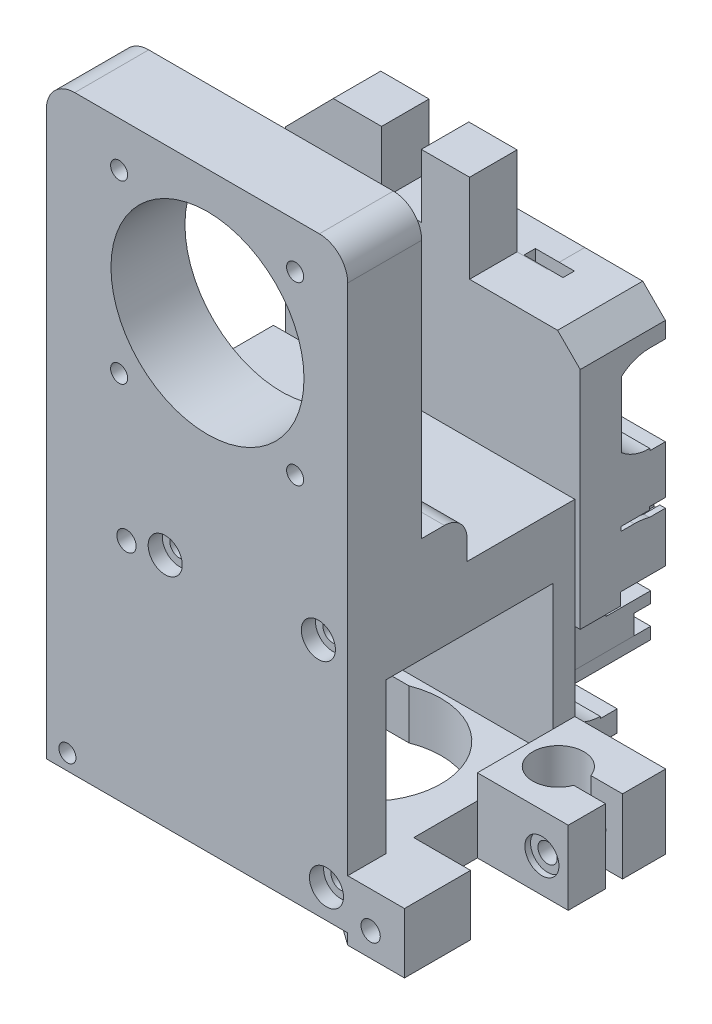
from build123d import *
from OCP.BRepAlgoAPI import BRepAlgoAPI_Cut
from OCP.TopTools import TopTools_ListOfShape

# Parameters (mm, degrees)
SKETCH1_W                     = 45
SKETCH1_H                     = 45
BOSS_EXTRUDE1_DEPTH           = 35
SKETCH2_R                     = 13
CUT_EXTRUDE3_DEPTH            = 35
SKETCH4_R                     = 1.7
CUT_EXTRUDE8_DEPTH            = 35
SKETCH7_R                     = 1.7
CUT_EXTRUDE9_DEPTH            = 35
SKETCH6_R                     = 1.7
CUT_EXTRUDE10_DEPTH           = 35
SKETCH5_R                     = 1.7
CUT_EXTRUDE11_DEPTH           = 35
CUT_EXTRUDE12_DEPTH           = 12
BOSS_EXTRUDE4_DEPTH           = 2
BOSS_EXTRUDE4_DEPTH_BACK      = 37.5
SKETCH14_W                    = 6
SKETCH14_H                    = 6
CUT_EXTRUDE17_START           = -7
SKETCH20_R                    = 2.2
CUT_EXTRUDE17_DEPTH           = 70.77141069
SKETCH21_R                    = 1.75
CUT_EXTRUDE18_DEPTH           = 2
BOSS_EXTRUDE5_DEPTH           = 44.571207257
BOSS_EXTRUDE5_DEPTH_BACK      = 1.562633388
SKETCH22_W                    = 53.082637552
SKETCH22_H                    = 40.002520942
SKETCH23_W                    = 29.449729346
SKETCH23_H                    = 26.517519529
CUT_EXTRUDE19_DEPTH           = 95.427299018
SKETCH25_R                    = 5
CUT_EXTRUDE24_DEPTH           = 2.6
SKETCH26_R                    = 8.1
CUT_EXTRUDE25_DEPTH           = 4
SKETCH27_R                    = 6.7
CUT_EXTRUDE28_DEPTH           = 6
SKETCH30_R                    = 13
CUT_EXTRUDE30_DEPTH           = 10.767560088
SKETCH31_W                    = 19.349450051
SKETCH31_H                    = 23.644133728
CUT_EXTRUDE31_DEPTH           = 9.664293754
SKETCH34_R                    = 1.5
CUT_EXTRUDE32_DEPTH           = 9
SKETCH37_W                    = 11.635024897
SKETCH37_H                    = 10.599921236
BOSS_EXTRUDE6_DEPTH           = 10
BOSS_EXTRUDE6_OTHER_WAY_DEPTH = 5
BOSS_EXTRUDE6_OTHER_WAY_TAPER = 29
SKETCH38_R                    = 1.700000001
CUT_EXTRUDE33_DEPTH           = 10
SKETCH39_R                    = 1.700000001
CUT_EXTRUDE34_DEPTH           = 88.0662855
SKETCH40_W                    = 17.159872711
SKETCH40_H                    = 13
BOSS_EXTRUDE7_DEPTH           = 16
SKETCH41_R                    = 4.5
CUT_EXTRUDE35_DEPTH           = 15
SKETCH42_W                    = 9.331425876
SKETCH42_H                    = 3
CUT_EXTRUDE36_DEPTH           = 15
CUT_EXTRUDE37_DEPTH           = 5
SKETCH44_R                    = 1.7
CUT_EXTRUDE38_DEPTH           = 23
CUT_EXTRUDE39_DEPTH           = 5
CUT_EXTRUDE40_DEPTH           = 5
CUT_EXTRUDE41_DEPTH           = 5
SKETCH53_R                    = 1.7
CUT_EXTRUDE42_DEPTH           = 90.646740997
SKETCH52_R                    = 1.7
CUT_EXTRUDE43_DEPTH           = 90.646740997
SKETCH51_R                    = 1.7
CUT_EXTRUDE44_DEPTH           = 90.646740997
CUT_EXTRUDE46_DEPTH           = 5
SKETCH57_R                    = 3
CUT_EXTRUDE48_DEPTH           = 2.5
SKETCH58_R                    = 3
CUT_EXTRUDE49_DEPTH           = 2.5
SKETCH59_R                    = 3
CUT_EXTRUDE50_DEPTH           = 2.5
SKETCH60_R                    = 3
CUT_EXTRUDE51_DEPTH           = 1
SKETCH61_W                    = 6.542017971
SKETCH61_H                    = 14.030300317
CUT_EXTRUDE52_DEPTH           = 6.5
SKETCH67_W                    = 5.604230097
SKETCH67_H                    = 8.996545788
BOSS_EXTRUDE8_DEPTH           = 33
SKETCH68_W                    = 5.604230097
SKETCH68_H                    = 9.400155495
BOSS_EXTRUDE9_DEPTH           = 33
SKETCH63_R                    = 1.7
CUT_EXTRUDE55_DEPTH           = 102.92049818
SKETCH62_R                    = 1.7
CUT_EXTRUDE56_DEPTH           = 102.92049818
SKETCH69_R                    = 3
CUT_EXTRUDE57_DEPTH           = 2.5
CUT_EXTRUDE58_DEPTH           = 2.5
SKETCH71_R                    = 3
CUT_EXTRUDE59_DEPTH           = 1
SKETCH73_R                    = 1.5
CUT_EXTRUDE61_DEPTH           = 5
SKETCH79_W                    = 95.658931194
SKETCH79_H                    = 51.290788201
CUT_EXTRUDE62_DEPTH           = 59
SKETCH80_W                    = 53.082637552
SKETCH80_H                    = 13.031868173
BOSS_EXTRUDE10_DEPTH          = 58
FILLET1_R                     = 5
SKETCH84_R                    = 17
CUT_EXTRUDE63_DEPTH           = 22
SKETCH85_R                    = 1.5
CUT_EXTRUDE64_DEPTH           = 15
SKETCH86_W                    = 15
SKETCH86_H                    = 8
BOSS_EXTRUDE11_DEPTH          = 7.5
FILLET3_R                     = 3
SKETCH87_W                    = 10
SKETCH87_H                    = 8
BOSS_EXTRUDE12_DEPTH          = 7.5
FILLET6_R                     = 4
BOSS_EXTRUDE13_DEPTH          = 15
SKETCH93_R                    = 7.627151398
CUT_EXTRUDE66_DEPTH           = 49.5
CUT_EXTRUDE67_DEPTH           = 53.5
SKETCH95_R                    = 7.676402713
CUT_EXTRUDE68_DEPTH           = 25.2
CUT_EXTRUDE69_DEPTH           = 34.5
CUT_EXTRUDE70_DEPTH           = 97.513539563
CUT_EXTRUDE70_DEPTH_BACK      = 97.513539563
SKETCH98_W                    = 8.013106882
SKETCH98_H                    = 5.054927498
SKETCH99_W                    = 2.898184018
SKETCH99_H                    = 3.4444183
CUT_EXTRUDE71_DEPTH           = 49.5
CUT_EXTRUDE75_DEPTH           = 2.8
CUT_EXTRUDE76_DEPTH           = 7.8
FILLET9_R                     = 10
CUT_EXTRUDE77_DEPTH           = 2.8
CUT_EXTRUDE78_DEPTH           = 7.8
SKETCH109_W                   = 3.474802874
SKETCH109_H                   = 1.768914447
SKETCH112_W                   = 3.556792111
SKETCH112_H                   = 1.806926474
CUT_EXTRUDE79_DEPTH           = 1
SKETCH116_W                   = 11.383905976
SKETCH116_H                   = 17.385394655
CUT_EXTRUDE80_DEPTH           = 64
CUT_EXTRUDE81_DEPTH           = 1


with BuildPart() as part:
    # Sketch1 → Boss-Extrude1 (new body)
    with BuildSketch(Plane.XY):
        Rectangle(SKETCH1_W, SKETCH1_H)
    extrude(amount=BOSS_EXTRUDE1_DEPTH)

    # Sketch2 → Cut-Extrude3 (cut)
    with BuildSketch(Plane.XY.offset(35)):
        Circle(SKETCH2_R)
    extrude(amount=-CUT_EXTRUDE3_DEPTH, mode=Mode.SUBTRACT)

    # Sketch4 → Cut-Extrude8 (cut)
    with BuildSketch(Plane(origin=(0, 0, 0), x_dir=(-1, 0, 0), z_dir=(0, 0, -1))):
        with Locations((-15.808862622, 15.928817575)):
            Circle(SKETCH4_R)
    extrude(amount=-CUT_EXTRUDE8_DEPTH, mode=Mode.SUBTRACT)

    # Sketch7 → Cut-Extrude9 (cut)
    with BuildSketch(Plane(origin=(0, 0, 0), x_dir=(-1, 0, 0), z_dir=(0, 0, -1))):
        with Locations((15.199970606, 15.923392722)):
            Circle(SKETCH7_R)
    extrude(amount=-CUT_EXTRUDE9_DEPTH, mode=Mode.SUBTRACT)

    # Sketch6 → Cut-Extrude10 (cut)
    with BuildSketch(Plane(origin=(0, 0, 0), x_dir=(-1, 0, 0), z_dir=(0, 0, -1))):
        with Locations((15.22029943, -15.065721832)):
            Circle(SKETCH6_R)
    extrude(amount=-CUT_EXTRUDE10_DEPTH, mode=Mode.SUBTRACT)

    # Sketch5 → Cut-Extrude11 (cut)
    with BuildSketch(Plane(origin=(0, 0, 0), x_dir=(-1, 0, 0), z_dir=(0, 0, -1))):
        with Locations((-15.781319068, -15.06525873)):
            Circle(SKETCH5_R)
    extrude(amount=-CUT_EXTRUDE11_DEPTH, mode=Mode.SUBTRACT)

    # Sketch8 → Cut-Extrude12 (cut)
    with BuildSketch(Plane(origin=(22.5, 0, 0), x_dir=(0, 0, -1), z_dir=(1, 0, 0))):
        Polygon((-4.363915061, -12.036124724), (-35, -12.036124724), (-35, 22.5), (-8.423058519, 22.5), (-8.423058519, 12.925541512), (-4.363915061, 12.925541512), align=None)
    extrude(amount=-CUT_EXTRUDE12_DEPTH, mode=Mode.SUBTRACT)

    # Sketch14 → Boss-Extrude4 (add, two sides: drawn at the far end of the back side and taken through both)
    with BuildSketch(Plane(origin=(0, 22.5, 0), x_dir=(1, 0, 0), z_dir=(0, 1, 0)).offset(-BOSS_EXTRUDE4_DEPTH_BACK)):
        with Locations((6.190916669, -17.729312446)):
            Rectangle(SKETCH14_W, SKETCH14_H)
    extrude(amount=BOSS_EXTRUDE4_DEPTH + BOSS_EXTRUDE4_DEPTH_BACK)

    # Sketch20 → Cut-Extrude17 (cut)
    with BuildSketch(Plane(origin=(0, 24.5, 0), x_dir=(1, 0, 0), z_dir=(0, 1, 0)).offset(CUT_EXTRUDE17_START)):
        with Locations(Location((6.190916669, -17.729312446, 0), (0, 0, 90))):
            Circle(SKETCH20_R)
    cut_extrude17 = extrude(amount=CUT_EXTRUDE17_DEPTH, mode=Mode.SUBTRACT)

    # Sketch21 → Cut-Extrude18 (cut)
    with BuildSketch(Plane(origin=(0, 17.5, 0), x_dir=(1, 0, 0), z_dir=(0, 1, 0))):
        with Locations(Location((6.190916669, -17.729312446, 0), (0, 0, 270))):
            Circle(SKETCH21_R)
    extrude(amount=-CUT_EXTRUDE18_DEPTH, mode=Mode.SUBTRACT)

    # Mirror6: Cut-Extrude17 across plane
    add(cut_extrude17.mirror(Plane.ZX.offset(16.5)), mode=Mode.SUBTRACT)

    # Sketch22 → Boss-Extrude5 (add, two sides: drawn at the far end of the back side and taken through both)
    with BuildSketch(Plane.XZ.offset(22.5).offset(-BOSS_EXTRUDE5_DEPTH_BACK)):
        with Locations((-1.541318776, 20.001258793)):
            Rectangle(SKETCH22_W, SKETCH22_H)
    extrude(amount=BOSS_EXTRUDE5_DEPTH + BOSS_EXTRUDE5_DEPTH_BACK)

    # Sketch23 → Cut-Extrude19 (cut, through all)
    with BuildSketch(Plane.ZY.offset(28.082637552)):
        with Locations((18.529138975, -45.100264067)):
            Rectangle(SKETCH23_W, SKETCH23_H)
    extrude(amount=-CUT_EXTRUDE19_DEPTH, mode=Mode.SUBTRACT)

    # Sketch25 → Cut-Extrude24 (cut)
    with BuildSketch(Plane(origin=(0, -20.937366612, 0), x_dir=(1, 0, 0), z_dir=(0, 1, 0))):
        with Locations(Location((6.190916669, -17.729312446, 0), (0, 0, 270))):
            Circle(SKETCH25_R)
    extrude(amount=-CUT_EXTRUDE24_DEPTH, mode=Mode.SUBTRACT)

    # Sketch26 → Cut-Extrude25 (cut)
    with BuildSketch(Plane(origin=(0, -23.537366612, 0), x_dir=(1, 0, 0), z_dir=(0, 1, 0))):
        with Locations(Location((6.190916669, -17.729312446, 0), (0, 0, 270))):
            Circle(SKETCH26_R)
    extrude(amount=-CUT_EXTRUDE25_DEPTH, mode=Mode.SUBTRACT)

    # Sketch27 → Cut-Extrude28 (cut)
    with BuildSketch(Plane(origin=(0, -27.537366612, 0), x_dir=(1, 0, 0), z_dir=(0, 1, 0))):
        with Locations(Location((6.190916669, -17.729312446, 0), (0, 0, 270))):
            Circle(SKETCH27_R)
    extrude(amount=-CUT_EXTRUDE28_DEPTH, mode=Mode.SUBTRACT)

    # Sketch30 → Cut-Extrude30 (cut)
    with BuildSketch(Plane(origin=(0, -58.359023831, 0), x_dir=(1, 0, 0), z_dir=(0, 1, 0))):
        with Locations(Location((6.207851035, -17.729312446, 0), (0, 0, 270))):
            Circle(SKETCH30_R)
    extrude(amount=-CUT_EXTRUDE30_DEPTH, mode=Mode.SUBTRACT)

    # Sketch31 → Cut-Extrude31 (cut)
    with BuildSketch(Plane.XZ.offset(67.071207257)):
        with Locations((-7.592166715, 17.462222744)):
            Rectangle(SKETCH31_W, SKETCH31_H)
    extrude(amount=-CUT_EXTRUDE31_DEPTH, mode=Mode.SUBTRACT)

    # Sketch34 → Cut-Extrude32 (cut)
    with BuildSketch(Plane.ZY.offset(28.082637552)):
        with Locations((35.530918006, -28.494957131)):
            Circle(SKETCH34_R)
        with Locations((3.530918006, -28.494957131)):
            Circle(SKETCH34_R)
        with Locations((35.530918006, -60.494957131)):
            Circle(SKETCH34_R)
        with Locations((3.530918006, -60.494957131)):
            Circle(SKETCH34_R)
    extrude(amount=-CUT_EXTRUDE32_DEPTH, mode=Mode.SUBTRACT)

    # Sketch37 → Boss-Extrude6 (add)
    with BuildSketch(Plane(origin=(25, 0, 0), x_dir=(0, 0, -1), z_dir=(1, 0, 0))):
        with Locations((-34.185004037, -63.658986353)):
            Rectangle(SKETCH37_W, SKETCH37_H)
    extrude(amount=BOSS_EXTRUDE6_DEPTH)

    # Sketch37 → Boss-Extrude6 other way (add)
    with BuildSketch(Plane(origin=(25, 0, 0), x_dir=(0, 0, -1), z_dir=(1, 0, 0))):
        with Locations((-34.185004037, -63.658986353)):
            Rectangle(SKETCH37_W, SKETCH37_H)
    extrude(amount=-BOSS_EXTRUDE6_OTHER_WAY_DEPTH, taper=BOSS_EXTRUDE6_OTHER_WAY_TAPER)

    # Sketch38 → Cut-Extrude33 (cut)
    with BuildSketch(Plane.XY.offset(40.002519264)):
        with Locations((29.034907303, -64.748396147)):
            Circle(SKETCH38_R)
    extrude(amount=-CUT_EXTRUDE33_DEPTH, mode=Mode.SUBTRACT)

    # Sketch39 → Cut-Extrude34 (cut, through all)
    with BuildSketch(Plane.XY.offset(40.002519264)):
        with Locations((-13.965092697, -26.748396147)):
            Circle(SKETCH39_R)
    extrude(amount=-CUT_EXTRUDE34_DEPTH, mode=Mode.SUBTRACT)

    # Sketch40 → Boss-Extrude7 (add)
    with BuildSketch(Plane(origin=(25, 0, 0), x_dir=(0, 0, -1), z_dir=(1, 0, 0))):
        with Locations((-8.579933523, -60.571207257)):
            Rectangle(SKETCH40_W, SKETCH40_H)
    extrude(amount=BOSS_EXTRUDE7_DEPTH)

    # Sketch41 → Cut-Extrude35 (cut)
    with BuildSketch(Plane(origin=(0, -54.071207257, 1.269334023), x_dir=(1, 0, 0), z_dir=(0, 1, 0))):
        with Locations(Location((31.163890056, -7.793414205, 0), (0, 0, 270))):
            Circle(SKETCH41_R)
    extrude(amount=-CUT_EXTRUDE35_DEPTH, mode=Mode.SUBTRACT)

    # Sketch42 → Cut-Extrude36 (cut)
    with BuildSketch(Plane(origin=(0, -54.071207257, 0), x_dir=(1, 0, 0), z_dir=(0, 1, 0))):
        with Locations((38.19390682, -9.095710432)):
            Rectangle(SKETCH42_W, SKETCH42_H)
    extrude(amount=-CUT_EXTRUDE36_DEPTH, mode=Mode.SUBTRACT)


with BuildPart() as cut_extrude37_tool:
    # Sketch43 → Cut-Extrude37 (new body)
    with BuildSketch(Plane(origin=(0, 0, 0), x_dir=(-1, 0, 0), z_dir=(0, 0, -1))):
        Polygon((-34.628927379, -64.403909926), (-32.738460245, -61.095415705), (-34.658466721, -57.80397603), (-38.468940333, -57.821030577), (-40.359407467, -61.129524799), (-38.439400991, -64.420964473), align=None)
    extrude(amount=-CUT_EXTRUDE37_DEPTH)


with BuildPart() as part_1:
    add(part.part)

    # Cut-Extrude37: cut by cut_extrude37_tool, with a tolerance
    cut_extrude37_stock = TopTools_ListOfShape()
    cut_extrude37_stock.Append(part_1.part.wrapped)
    cut_extrude37_tools = TopTools_ListOfShape()
    cut_extrude37_tools.Append(cut_extrude37_tool.part.wrapped)
    cut_extrude37_cut = BRepAlgoAPI_Cut()
    cut_extrude37_cut.SetArguments(cut_extrude37_stock)
    cut_extrude37_cut.SetTools(cut_extrude37_tools)
    cut_extrude37_cut.SetFuzzyValue(0.00001)
    cut_extrude37_cut.Build()
    add(Compound.cast(cut_extrude37_cut.Shape()).solids(), mode=Mode.REPLACE)

    # Sketch44 → Cut-Extrude38 (cut)
    with BuildSketch(Plane.XY.offset(17.159869878)):
        with Locations(Location((36.360549159, -61.087091915, 0), (0, 0, 123.670539257))):
            Circle(SKETCH44_R)
    extrude(amount=-CUT_EXTRUDE38_DEPTH, mode=Mode.SUBTRACT)


with BuildPart() as cut_extrude39_tool:
    # Sketch48 → Cut-Extrude39 (new body)
    with BuildSketch(Plane(origin=(0, 0, 0), x_dir=(-1, 0, 0), z_dir=(0, 0, -1))):
        Polygon((9.066729233, -28.811078933), (10.957196368, -25.502584711), (9.037189891, -22.211145037), (5.22671628, -22.228199584), (3.336249145, -25.536693806), (5.256255622, -28.82813348), align=None)
    extrude(amount=-CUT_EXTRUDE39_DEPTH)


with BuildPart() as part_2:
    add(part_1.part)

    # Cut-Extrude39: cut by cut_extrude39_tool, with a tolerance
    cut_extrude39_stock = TopTools_ListOfShape()
    cut_extrude39_stock.Append(part_2.part.wrapped)
    cut_extrude39_tools = TopTools_ListOfShape()
    cut_extrude39_tools.Append(cut_extrude39_tool.part.wrapped)
    cut_extrude39_cut = BRepAlgoAPI_Cut()
    cut_extrude39_cut.SetArguments(cut_extrude39_stock)
    cut_extrude39_cut.SetTools(cut_extrude39_tools)
    cut_extrude39_cut.SetFuzzyValue(0.00001)
    cut_extrude39_cut.Build()
    add(Compound.cast(cut_extrude39_cut.Shape()).solids(), mode=Mode.REPLACE)


with BuildPart() as cut_extrude40_tool:
    # Sketch49 → Cut-Extrude40 (new body)
    with BuildSketch(Plane(origin=(0, 0, 0), x_dir=(-1, 0, 0), z_dir=(0, 0, -1))):
        Polygon((-19.339505263, -65.26594849), (-17.449038128, -61.957454268), (-19.369044605, -58.666014594), (-23.179518216, -58.683069141), (-25.06998535, -61.991563363), (-23.149978874, -65.283003037), align=None)
    extrude(amount=-CUT_EXTRUDE40_DEPTH)


with BuildPart() as part_3:
    add(part_2.part)

    # Cut-Extrude40: cut by cut_extrude40_tool, with a tolerance
    cut_extrude40_stock = TopTools_ListOfShape()
    cut_extrude40_stock.Append(part_3.part.wrapped)
    cut_extrude40_tools = TopTools_ListOfShape()
    cut_extrude40_tools.Append(cut_extrude40_tool.part.wrapped)
    cut_extrude40_cut = BRepAlgoAPI_Cut()
    cut_extrude40_cut.SetArguments(cut_extrude40_stock)
    cut_extrude40_cut.SetTools(cut_extrude40_tools)
    cut_extrude40_cut.SetFuzzyValue(0.00001)
    cut_extrude40_cut.Build()
    add(Compound.cast(cut_extrude40_cut.Shape()).solids(), mode=Mode.REPLACE)


with BuildPart() as cut_extrude41_tool:
    # Sketch50 → Cut-Extrude41 (new body)
    with BuildSketch(Plane(origin=(0, 0, 0), x_dir=(-1, 0, 0), z_dir=(0, 0, -1))):
        Polygon((-17.911640095, -28.243498116), (-16.02117296, -24.935003895), (-17.941179437, -21.64356422), (-21.751653048, -21.660618767), (-23.642120183, -24.969112989), (-21.722113706, -28.260552663), align=None)
    extrude(amount=-CUT_EXTRUDE41_DEPTH)


with BuildPart() as part_4:
    add(part_3.part)

    # Cut-Extrude41: cut by cut_extrude41_tool, with a tolerance
    cut_extrude41_stock = TopTools_ListOfShape()
    cut_extrude41_stock.Append(part_4.part.wrapped)
    cut_extrude41_tools = TopTools_ListOfShape()
    cut_extrude41_tools.Append(cut_extrude41_tool.part.wrapped)
    cut_extrude41_cut = BRepAlgoAPI_Cut()
    cut_extrude41_cut.SetArguments(cut_extrude41_stock)
    cut_extrude41_cut.SetTools(cut_extrude41_tools)
    cut_extrude41_cut.SetFuzzyValue(0.00001)
    cut_extrude41_cut.Build()
    add(Compound.cast(cut_extrude41_cut.Shape()).solids(), mode=Mode.REPLACE)

    # Sketch53 → Cut-Extrude42 (cut, through all)
    with BuildSketch(Plane.XY.offset(40.002519264)):
        with Locations((21.259511739, -61.974508816)):
            Circle(SKETCH53_R)
    extrude(amount=-CUT_EXTRUDE42_DEPTH, mode=Mode.SUBTRACT)

    # Sketch52 → Cut-Extrude43 (cut, through all)
    with BuildSketch(Plane.XY.offset(40.002519264)):
        with Locations((19.831646572, -24.952058442)):
            Circle(SKETCH52_R)
    extrude(amount=-CUT_EXTRUDE43_DEPTH, mode=Mode.SUBTRACT)

    # Sketch51 → Cut-Extrude44 (cut, through all)
    with BuildSketch(Plane.XY.offset(40.002519264)):
        with Locations((-7.146722757, -25.519639258)):
            Circle(SKETCH51_R)
    extrude(amount=-CUT_EXTRUDE44_DEPTH, mode=Mode.SUBTRACT)


with BuildPart() as cut_extrude46_tool:
    # Sketch55 → Cut-Extrude46 (new body)
    with BuildSketch(Plane(origin=(0, 0, 0), x_dir=(-1, 0, 0), z_dir=(0, 0, -1))):
        Polygon((16.745274795, -30.164507999), (18.313623392, -26.048743749), (15.533441294, -22.632631898), (11.1849106, -23.332284296), (9.616562003, -27.448048545), (12.396744101, -30.864160397), align=None)
    extrude(amount=-CUT_EXTRUDE46_DEPTH)


with BuildPart() as part_5:
    add(part_4.part)

    # Cut-Extrude46: cut by cut_extrude46_tool, with a tolerance
    cut_extrude46_stock = TopTools_ListOfShape()
    cut_extrude46_stock.Append(part_5.part.wrapped)
    cut_extrude46_tools = TopTools_ListOfShape()
    cut_extrude46_tools.Append(cut_extrude46_tool.part.wrapped)
    cut_extrude46_cut = BRepAlgoAPI_Cut()
    cut_extrude46_cut.SetArguments(cut_extrude46_stock)
    cut_extrude46_cut.SetTools(cut_extrude46_tools)
    cut_extrude46_cut.SetFuzzyValue(0.00001)
    cut_extrude46_cut.Build()
    add(Compound.cast(cut_extrude46_cut.Shape()).solids(), mode=Mode.REPLACE)

    # Sketch57 → Cut-Extrude48 (cut)
    with BuildSketch(Plane.XY.offset(40.002519264)):
        with Locations((-7.146722757, -25.519639258)):
            Circle(SKETCH57_R)
    extrude(amount=-CUT_EXTRUDE48_DEPTH, mode=Mode.SUBTRACT)

    # Sketch58 → Cut-Extrude49 (cut)
    with BuildSketch(Plane.XY.offset(40.002519264)):
        with Locations((19.831646572, -24.952058442)):
            Circle(SKETCH58_R)
    extrude(amount=-CUT_EXTRUDE49_DEPTH, mode=Mode.SUBTRACT)

    # Sketch59 → Cut-Extrude50 (cut)
    with BuildSketch(Plane.XY.offset(40.002519264)):
        with Locations((21.259511739, -61.974508816)):
            Circle(SKETCH59_R)
    extrude(amount=-CUT_EXTRUDE50_DEPTH, mode=Mode.SUBTRACT)

    # Sketch60 → Cut-Extrude51 (cut)
    with BuildSketch(Plane(origin=(0, 0, 0), x_dir=(-1, 0, 0), z_dir=(0, 0, -1))):
        with Locations((-15.808862622, 15.928817575)):
            Circle(SKETCH60_R)
        with Locations((15.199970606, 15.923392722)):
            Circle(SKETCH60_R)
        with Locations((-15.781319068, -15.06525873)):
            Circle(SKETCH60_R)
        with Locations((15.22029943, -15.065721832)):
            Circle(SKETCH60_R)
    extrude(amount=-CUT_EXTRUDE51_DEPTH, mode=Mode.SUBTRACT)

    # Sketch61 → Cut-Extrude52 (cut)
    with BuildSketch(Plane(origin=(9.190916669, 0, 0), x_dir=(0, 0, -1), z_dir=(1, 0, 0))):
        with Locations((-17.812553374, 0.202623489)):
            Rectangle(SKETCH61_W, SKETCH61_H)
    extrude(amount=-CUT_EXTRUDE52_DEPTH, mode=Mode.SUBTRACT)

    # Sketch67 → Boss-Extrude8 (add)
    with BuildSketch(Plane(origin=(-22.5, -2.468350024, 0), x_dir=(0, 0, 1), z_dir=(-1, 0, 0))):
        with Locations((29.51622543, -5.940778019)):
            Rectangle(SKETCH67_W, SKETCH67_H)
    extrude(amount=-BOSS_EXTRUDE8_DEPTH)

    # Sketch68 → Boss-Extrude9 (add)
    with BuildSketch(Plane(origin=(-22.5, -2.468350024, 0), x_dir=(0, 0, 1), z_dir=(-1, 0, 0))):
        with Locations((9.47264346, -5.966332429)):
            Rectangle(SKETCH68_W, SKETCH68_H)
    extrude(amount=-BOSS_EXTRUDE9_DEPTH)

    # Sketch63 → Cut-Extrude55 (cut, through all)
    with BuildSketch(Plane.ZY.offset(22.5)):
        with Locations(Location((29.516225429, -7.068802512, 0), (0, 0, 270))):
            Circle(SKETCH63_R)
    extrude(amount=-CUT_EXTRUDE55_DEPTH, mode=Mode.SUBTRACT)

    # Sketch62 → Cut-Extrude56 (cut, through all)
    with BuildSketch(Plane.ZY.offset(22.5)):
        with Locations(Location((9.403782955, -7.127149089, 0), (0, 0, 270))):
            Circle(SKETCH62_R)
    extrude(amount=-CUT_EXTRUDE56_DEPTH, mode=Mode.SUBTRACT)

    # Sketch69 → Cut-Extrude57 (cut)
    with BuildSketch(Plane.ZY.offset(22.5)):
        with Locations(Location((9.403782955, -7.127149089, 0), (0, 0, 270))):
            Circle(SKETCH69_R)
        with Locations(Location((29.516225429, -7.068802512, 0), (0, 0, 270))):
            Circle(SKETCH69_R)
    extrude(amount=-CUT_EXTRUDE57_DEPTH, mode=Mode.SUBTRACT)

    # Sketch70 → Cut-Extrude58 (cut)
    with BuildSketch(Plane(origin=(0, 0, 28.367491588), x_dir=(-1, 0, 0), z_dir=(0, 0, -1))):
        Polygon((-25.057295961, -66.811454801), (-25.259440428, -62.335213005), (-29.23705177, -60.272154352), (-33.012518645, -62.685337494), (-32.810374177, -67.161579289), (-28.832762835, -69.224637943), align=None)
    extrude(amount=-CUT_EXTRUDE58_DEPTH, mode=Mode.SUBTRACT)

    # Sketch71 → Cut-Extrude59 (cut)
    with BuildSketch(Plane.XY.offset(17.159869878)):
        with Locations((36.360549159, -61.087091915)):
            Circle(SKETCH71_R)
    extrude(amount=-CUT_EXTRUDE59_DEPTH, mode=Mode.SUBTRACT)

    # Sketch73 → Cut-Extrude61 (cut)
    with BuildSketch(Plane.XY.offset(40.002519264)):
        with Locations((-24.369276222, -64.32278971)):
            Circle(SKETCH73_R)
    extrude(amount=-CUT_EXTRUDE61_DEPTH, mode=Mode.SUBTRACT)

    # Sketch79 → Cut-Extrude62 (cut)
    with BuildSketch(Plane(origin=(0, -20.937366612, 0), x_dir=(1, 0, 0), z_dir=(0, 1, 0))):
        with Locations((-4.270574665, -23.740541644)):
            Rectangle(SKETCH79_W, SKETCH79_H)
    extrude(amount=CUT_EXTRUDE62_DEPTH, mode=Mode.SUBTRACT)

    # Sketch80 → Boss-Extrude10 (add)
    with BuildSketch(Plane(origin=(0, -20.937366612, 0), x_dir=(1, 0, 0), z_dir=(0, 1, 0))):
        with Locations((-1.541318776, -33.486585178)):
            Rectangle(SKETCH80_W, SKETCH80_H)
    extrude(amount=BOSS_EXTRUDE10_DEPTH)

    # Fillet1
    fillet1_edges = [part_5.edges().sort_by_distance(p)[0] for p in [
        (-28.082637552, 37.062633388, 33.486585177),
        (25, 37.062633388, 33.486585177),
    ]]
    fillet(fillet1_edges, radius=FILLET1_R)

    # Sketch84 → Cut-Extrude63 (cut)
    with BuildSketch(Plane(origin=(0, 0, 26.970651091), x_dir=(-1, 0, 0), z_dir=(0, 0, -1))):
        with Locations((-0.29898878, 13.603645853)):
            Circle(SKETCH84_R)
    extrude(amount=-CUT_EXTRUDE63_DEPTH, mode=Mode.SUBTRACT)

    # Sketch85 → Cut-Extrude64 (cut)
    with BuildSketch(Plane.XY.offset(40.002519264)):
        with Locations((15.736832887, 29.13557467)):
            Circle(SKETCH85_R)
        with Locations((15.736832887, -1.86442533)):
            Circle(SKETCH85_R)
        with Locations((-15.263167113, -1.86442533)):
            Circle(SKETCH85_R)
        with Locations((-15.263167113, 29.13557467)):
            Circle(SKETCH85_R)
    extrude(amount=-CUT_EXTRUDE64_DEPTH, mode=Mode.SUBTRACT)

    # Sketch86 → Boss-Extrude11 (add)
    with BuildSketch(Plane(origin=(0, -20.937366612, 0), x_dir=(1, 0, 0), z_dir=(0, 1, 0))):
        with Locations((-20.582637552, -22.970651091)):
            Rectangle(SKETCH86_W, SKETCH86_H)
    extrude(amount=BOSS_EXTRUDE11_DEPTH)

    # Fillet3
    fillet3_edges = [part_5.edges().sort_by_distance(p)[0] for p in [
        (-20.582637552, -13.437366612, 18.970651091),
    ]]
    fillet(fillet3_edges, radius=FILLET3_R)

    # Sketch87 → Boss-Extrude12 (add)
    with BuildSketch(Plane(origin=(0, -20.937366612, 0), x_dir=(1, 0, 0), z_dir=(0, 1, 0))):
        with Locations((20, -22.970651091)):
            Rectangle(SKETCH87_W, SKETCH87_H)
    extrude(amount=BOSS_EXTRUDE12_DEPTH)

    # Fillet6
    fillet6_edges = [part_5.edges().sort_by_distance(p)[0] for p in [
        (20, -13.437366612, 18.970651091),
    ]]
    fillet(fillet6_edges, radius=FILLET6_R)

    # Sketch90 → Boss-Extrude13 (add)
    with BuildSketch(Plane(origin=(0, 0, 0), x_dir=(-1, 0, 0), z_dir=(0, 0, -1))):
        Polygon((17.037255803, -68.36197067), (17.037255803, -50.689145022), (26.017272956, -50.689145022), (26.017272956, -40.681920979), (25.993659225, -36.474000388), (25.993659225, 10.373411619), (17.549011758, 18.922680584), (9.039575962, 18.922680584), (9.039575962, 7.780578291), (2.010790556, 7.780578291), (2.041381355, 18.922680584), (-6.46274534, 18.922680584), (-6.46274534, 3.355731571), (-21.962746009, 3.324374492), (-25.955095041, -0.667921289), (-25.955095041, -36.660306041), (-25.955095041, -40.308078249), (-23.36274568, -40.308078249), (-23.36274568, -43.180320629), (-23.36274568, -48.619339256), (-23.367757646, -50.680300201), (-17.462746069, -50.680300201), (-17.462746069, -67.863551646), (-14.177545807, -71.190127808), (14.249697088, -71.190127808), align=None)
    extrude(amount=BOSS_EXTRUDE13_DEPTH)

    # Sketch93 → Cut-Extrude66 (cut)
    with BuildSketch(Plane(origin=(24.955095041, 0, 0), x_dir=(0, 0, -1), z_dir=(1, 0, 0))):
        with Locations((12.256212071, -11.171428731)):
            Circle(SKETCH93_R)
    extrude(amount=-CUT_EXTRUDE66_DEPTH, mode=Mode.SUBTRACT)

    # Sketch94 → Cut-Extrude67 (cut)
    with BuildSketch(Plane(origin=(25.955095041, 0, 0), x_dir=(0, 0, -1), z_dir=(1, 0, 0))):
        with BuildLine():
            Line((7.304469319, -5.317971055), (7.304469319, -17.0155586))
            ThreePointArc((7.304469319, -17.0155586), (9.618622803, -18.361450318), (12.254533613, -18.82910945))
            Line((12.254533613, -18.82910945), (12.247539174, -19.175326281))
            Line((12.247539174, -19.175326281), (15.247498718, -19.190821279))
            Line((15.247498718, -19.190821279), (15.247498718, -18.220394035))
            ThreePointArc((15.247498718, -18.220394035), (19.890575189, -11.801110292), (16.37036652, -4.703681616))
            Line((16.37036652, -4.703681616), (16.37036652, -3.504420205))
            Line((16.37036652, -3.504420205), (12.254533613, -3.504420205))
            ThreePointArc((12.254533613, -3.504420205), (9.618622803, -3.972079337), (7.304469319, -5.317971055))
        make_face()
    extrude(amount=-CUT_EXTRUDE67_DEPTH, mode=Mode.SUBTRACT)

    # Sketch95 → Cut-Extrude68 (cut)
    with BuildSketch(Plane(origin=(12.462746069, 0, 0), x_dir=(0, 0, -1), z_dir=(1, 0, 0))):
        with Locations((12.092444965, -56.175071744)):
            Circle(SKETCH95_R)
    extrude(amount=-CUT_EXTRUDE68_DEPTH, mode=Mode.SUBTRACT)


with BuildPart() as cut_extrude69_tool:
    # Sketch96 → Cut-Extrude69 (new body)
    with BuildSketch(Plane(origin=(17.462746069, 0, 0), x_dir=(0, 0, -1), z_dir=(1, 0, 0))):
        with BuildLine():
            Line((7.026567917, -61.944543955), (7.093866549, -50.680300201))
            Line((7.093866549, -50.680300201), (18.039621023, -50.680300201))
            ThreePointArc((18.039621023, -50.680300201), (19.821216346, -57.783077051), (15, -63.294827572))
            Line((15, -63.294827572), (15, -64.164154351))
            Line((15, -64.164154351), (12.017415984, -64.164154351))
            Line((12.017415984, -64.164154351), (12.017415984, -63.827835882))
            ThreePointArc((12.017415984, -63.827835882), (9.358123262, -63.320452774), (7.026567917, -61.944543955))
        make_face()
    extrude(amount=-CUT_EXTRUDE69_DEPTH)


with BuildPart() as part_6:
    add(part_5.part)

    # Cut-Extrude69: cut by cut_extrude69_tool, with a tolerance
    cut_extrude69_stock = TopTools_ListOfShape()
    cut_extrude69_stock.Append(part_6.part.wrapped)
    cut_extrude69_tools = TopTools_ListOfShape()
    cut_extrude69_tools.Append(cut_extrude69_tool.part.wrapped)
    cut_extrude69_cut = BRepAlgoAPI_Cut()
    cut_extrude69_cut.SetArguments(cut_extrude69_stock)
    cut_extrude69_cut.SetTools(cut_extrude69_tools)
    cut_extrude69_cut.SetFuzzyValue(0.00001)
    cut_extrude69_cut.Build()
    add(Compound.cast(cut_extrude69_cut.Shape()).solids(), mode=Mode.REPLACE)

    # Sketch98 → Cut-Extrude70 (cut, two sides: drawn at the far end of the back side and taken through both)
    with BuildSketch(Plane(origin=(23.36274568, 0, 0), x_dir=(0, 0, -1), z_dir=(1, 0, 0)).offset(-CUT_EXTRUDE70_DEPTH_BACK)):
        with Locations((11.116985965, -40.66303761)):
            Rectangle(SKETCH98_W, SKETCH98_H)
    extrude(amount=CUT_EXTRUDE70_DEPTH + CUT_EXTRUDE70_DEPTH_BACK, mode=Mode.SUBTRACT)

    # Sketch99 → Cut-Extrude71 (cut)
    with BuildSketch(Plane(origin=(23.36274568, 0, 0), x_dir=(0, 0, -1), z_dir=(1, 0, 0))):
        with Locations((13.550907991, -46.897130106)):
            Rectangle(SKETCH99_W, SKETCH99_H)
    extrude(amount=-CUT_EXTRUDE71_DEPTH, mode=Mode.SUBTRACT)

    # Sketch104 → Cut-Extrude75 (cut)
    with BuildSketch(Plane(origin=(0, 0, -15), x_dir=(-1, 0, 0), z_dir=(0, 0, -1))):
        Polygon((-25.962747095, -29.314686028), (-24.96280414, -29.314686028), (-24.962745068, -30.066577416), (-23.962746767, -30.066577416), (-23.962555313, -29.299441116), (-22.961420056, -29.299441116), (-22.962748465, -30.066577416), (-21.962746439, -30.066577416), (-21.962746439, -29.314686028), (-20.962748138, -29.314686028), (-20.962748138, -30.066577416), (-19.962746111, -30.066577416), (-19.962746111, -29.299986228), (-19.144147096, -28.918292488), (-18.826346306, -29.599683698), (-17.920043275, -29.177095608), (-18.237847297, -28.495596886), (-17.33154498, -28.073009129), (-17.013747421, -28.754493991), (-16.107448591, -28.33179631), (-16.425247698, -27.650408709), (-15.518847316, -27.227813689), (-15.201147108, -27.9092049), (-14.294844791, -27.486617142), (-14.552147522, -26.934719209), (-13.762747332, -26.934719209), (-13.762747332, -27.686608735), (-12.762747168, -27.686608735), (-12.758801937, -26.913738568), (-11.762747004, -26.934719209), (-11.762747004, -27.686608735), (-10.76274684, -27.686608735), (-10.76274684, -26.934719209), (-9.762746677, -26.934719209), (-9.762746677, -27.686608735), (-8.762746512, -27.686608735), (-8.762746512, -26.934719209), (-7.762746349, -26.934719209), (-7.762746349, -27.686608735), (-6.854745954, -27.686608735), (-6.836747215, -25.281740545), (-6.838062023, -25.283268804), (-15.295775537, -25.339216406), (-20.3314935, -27.686608735), (-25.955095041, -27.686608735), align=None)
    extrude(amount=-CUT_EXTRUDE75_DEPTH, mode=Mode.SUBTRACT)

    # Sketch100 → Cut-Extrude76 (cut)
    with BuildSketch(Plane(origin=(0, 0, -15), x_dir=(-1, 0, 0), z_dir=(0, 0, -1))):
        Polygon((-25.955095041, -28.945247979), (-24.96280414, -28.945247979), (-24.96280414, -29.653634253), (-23.962555313, -29.653634253), (-23.962555313, -28.945247979), (-22.96424876, -28.945247979), (-22.958591351, -29.653634253), (-21.96304054, -29.653634253), (-21.96304054, -28.945247979), (-20.964934987, -28.945247979), (-20.959285676, -29.652620306), (-19.966016734, -29.644687729), (-19.972347716, -28.851960783), (-19.311248099, -28.543611164), (-19.008595517, -29.192496369), (-18.101434673, -28.769379045), (-18.404087256, -28.120493839), (-17.504286227, -27.700809274), (-17.201633644, -28.34969448), (-16.290191613, -27.924580327), (-16.592844196, -27.275695121), (-15.694477438, -26.856679528), (-15.219820827, -27.874340274), (-14.310167076, -27.450060209), (-14.728288096, -26.553611409), (-13.753525037, -26.553611409), (-13.753525037, -27.273865726), (-12.758801937, -27.273865726), (-12.758801937, -26.553611409), (-11.754470509, -26.553611409), (-11.754470509, -27.273865726), (-10.75686259, -27.273865726), (-10.75686259, -26.553611409), (-9.753121992, -26.553611409), (-9.753121992, -27.273865726), (-8.756088304, -27.273865726), (-8.756088304, -26.553611409), (-7.751750339, -26.553611409), (-7.751750339, -27.273865726), (-7.458768632, -27.273865726), (-6.712940952, -27.776466421), (-6.455012931, -27.900295376), (-6.808295478, -25.767524786), (-15.079976742, -25.767524786), (-20.197235679, -28.15997504), (-25.955095041, -28.199343388), align=None)
    extrude(amount=-CUT_EXTRUDE76_DEPTH, mode=Mode.SUBTRACT)

    # Fillet9
    # the kernel refuses this fillet: 10 mm, written as the material it takes off along each edge
    with BuildSketch(Plane(origin=(25.955095041, -28.945247979, -12.2), x_dir=(0, -1, 0), z_dir=(-1, 0, 0))) as fillet9_piece_1:
        with BuildLine():
            CenterArc((10, 2.693005104), FILLET9_R, 180, 15.622647397)
            Line((0, 2.693005104), (-0.2, 2.693005104))
            Line((-0.2, 2.693005104), (-0.2, 0))
            Line((-0.2, 0), (0, -0.2))
            ThreePointArc((0, -0.2), (0.184719024, -0.2), (0.176826809, -0.053860102))
            Line((0.176826809, -0.053860102), (0.369438048, 0))
        make_face()
    extrude(amount=0.992290901, mode=Mode.SUBTRACT)

    # Sketch107 → Cut-Extrude77 (cut)
    with BuildSketch(Plane(origin=(0, 0, -15), x_dir=(-1, 0, 0), z_dir=(0, 0, -1))):
        Polygon((8.687253647, -27.116615257), (8.687253647, -26.364725731), (9.687253345, -26.364725731), (9.687253345, -27.116615257), (10.687253509, -27.116615257), (10.687253509, -26.364725731), (11.300593219, -26.364725731), (11.504443433, -26.482424708), (11.128503435, -27.133516674), (11.994533312, -27.633509155), (12.370473311, -26.98241719), (13.23649666, -27.482405902), (12.860554217, -28.133502102), (13.726584095, -28.633494583), (14.102523287, -27.982404015), (14.968546637, -28.482392727), (14.592604194, -29.133488927), (15.458634159, -29.633481459), (15.83457287, -28.982391722), (16.70059837, -29.482381676), (16.324657404, -30.133475318), (17.190685132, -30.633466558), (17.566623356, -29.982377665), (18.432646619, -30.482366327), (18.05670665, -31.133458242), (18.922736702, -31.633450824), (19.298673448, -30.98236449), (20.037253462, -31.408759256), (20.037253462, -32.066549204), (21.03725316, -32.066549204), (21.03725316, -31.314659678), (22.037253324, -31.314659678), (22.037253324, -32.066549204), (23.037253488, -32.066549204), (23.037253488, -31.314659678), (24.037253186, -31.314659678), (24.037253186, -32.066549204), (25.037253816, -32.066549204), (25.037253816, -31.307907657), (26.037253048, -31.314659678), (25.993659225, -30.182050347), (20.166533002, -30.182050347), (11.585187457, -25.26675256), (8.223678341, -25.225537355), (7.936525965, -27.116615257), align=None)
    extrude(amount=-CUT_EXTRUDE77_DEPTH, mode=Mode.SUBTRACT)

    # Sketch108 → Cut-Extrude78 (cut)
    with BuildSketch(Plane(origin=(0, 0, -15), x_dir=(-1, 0, 0), z_dir=(0, 0, -1))):
        Polygon((8.226439423, -26.699867267), (8.658716653, -26.732210962), (8.658716653, -25.962704734), (9.664352311, -25.962704734), (9.687253345, -26.699401718), (10.687253509, -26.699401718), (10.687253509, -25.962704734), (11.404382143, -25.962704734), (11.706675461, -26.117537897), (11.360435825, -26.793529567), (12.182503311, -27.307963172), (12.558809802, -26.656236477), (13.409910595, -27.147661418), (13.048525439, -27.807954002), (13.914553691, -28.307949299), (14.302417941, -27.636140183), (15.163884185, -28.133501637), (14.780573386, -28.80794341), (15.64658102, -29.307975549), (16.037904671, -28.630240574), (16.903451672, -29.130006745), (16.512627887, -29.807928497), (17.336177211, -30.282706984), (17.751550635, -29.618938167), (18.625090615, -30.122536407), (18.256107931, -30.773265697), (19.110665426, -31.266638434), (19.484994425, -30.618273358), (20.046502181, -30.942455896), (20.044424464, -31.649335664), (21.03725316, -31.649335664), (21.03725316, -30.896614279), (22.038752496, -30.896614279), (22.037253324, -31.649335664), (23.037253488, -31.649335664), (23.037253488, -30.896614279), (24.031061878, -30.896614279), (24.037253186, -31.649335664), (25.037253816, -31.649335664), (25.037253816, -30.896614279), (26.037253887, -30.912138111), (25.993659225, -29.661682877), (20.084292403, -29.661682877), (11.510643246, -24.711747068), (7.735310008, -24.675249023), align=None)
    extrude(amount=-CUT_EXTRUDE78_DEPTH, mode=Mode.SUBTRACT)

    # Cut-Sweep2: sweep along a path in Sketch111
    with BuildLine(Plane.ZY.offset(20.993659225)) as cut_sweep2_path:
        CenterArc((-11.50693286, -11.111866598), 9.973751919, 0, 360)
    # Sketch109 → Cut-Sweep2 (sweep, cut)
    with BuildSketch(Plane(origin=(0, 0, -15), x_dir=(-1, 0, 0), z_dir=(0, 0, -1))):
        with Locations((21.04243553, -1.343740229)):
            Rectangle(SKETCH109_W, SKETCH109_H)
    sweep(path=cut_sweep2_path.line, mode=Mode.SUBTRACT)

    # Cut-Sweep3: sweep along a path in Sketch113
    with BuildLine(Plane(origin=(18.955095041, 0, 0), x_dir=(0, 0, -1), z_dir=(1, 0, 0))) as cut_sweep3_path:
        CenterArc((13.330486874, -11.194855704), 9.887595381, 0, 360)
    # Sketch112 → Cut-Sweep3 (sweep, cut)
    with BuildSketch(Plane(origin=(0, 0, -15), x_dir=(-1, 0, 0), z_dir=(0, 0, -1))):
        with Locations((-18.958959775, -1.325392729)):
            Rectangle(SKETCH112_W, SKETCH112_H)
    sweep(path=cut_sweep3_path.line, mode=Mode.SUBTRACT)

    # Sketch115 → Cut-Extrude79 (cut, symmetric)
    with BuildSketch(Plane(origin=(0, 0, -9.5), x_dir=(-1, 0, 0), z_dir=(0, 0, -1))):
        Polygon((-14.418603844, -0.163078289), (-14.418603844, 4.227668486), (-7.544895519, 4.685486594), (-7.544895519, -0.163078289), (-9.2633226, -3.139481303), (-12.700176763, -3.139481303), align=None)
        Polygon((9.027915526, -0.163078289), (10.749219434, -3.144464114), (14.191827251, -3.144464114), (15.913131159, -0.163078289), (15.913131159, 4.395411301), (9.027915526, 4.050034744), align=None)
    extrude(amount=CUT_EXTRUDE79_DEPTH, both=True, mode=Mode.SUBTRACT)

    # Sketch116 → Cut-Extrude80 (cut)
    with BuildSketch(Plane.ZY.offset(25.993659225)):
        with Locations((-14.055766201, 12.03773182)):
            Rectangle(SKETCH116_W, SKETCH116_H)
    extrude(amount=-CUT_EXTRUDE80_DEPTH, mode=Mode.SUBTRACT)

    # Sketch117 → Cut-Extrude81 (cut, symmetric)
    with BuildSketch(Plane(origin=(0, 0, -11.2), x_dir=(-1, 0, 0), z_dir=(0, 0, -1))):
        Polygon((-12.802402757, -67.141982284), (-12.802402757, -62.548577137), (-6.895710068, -62.548577137), (-7.028900065, -67.141982284), (-8.472275738, -69.641982284), (-11.359027084, -69.641982284), align=None)
        Polygon((11.458330412, -69.685420104), (12.901706085, -67.185420104), (12.901706085, -62.687540344), (7.128203393, -62.687540344), (7.128203393, -67.185420104), (8.571579066, -69.685420104), align=None)
    extrude(amount=CUT_EXTRUDE81_DEPTH, both=True, mode=Mode.SUBTRACT)


solid = part_6.part
